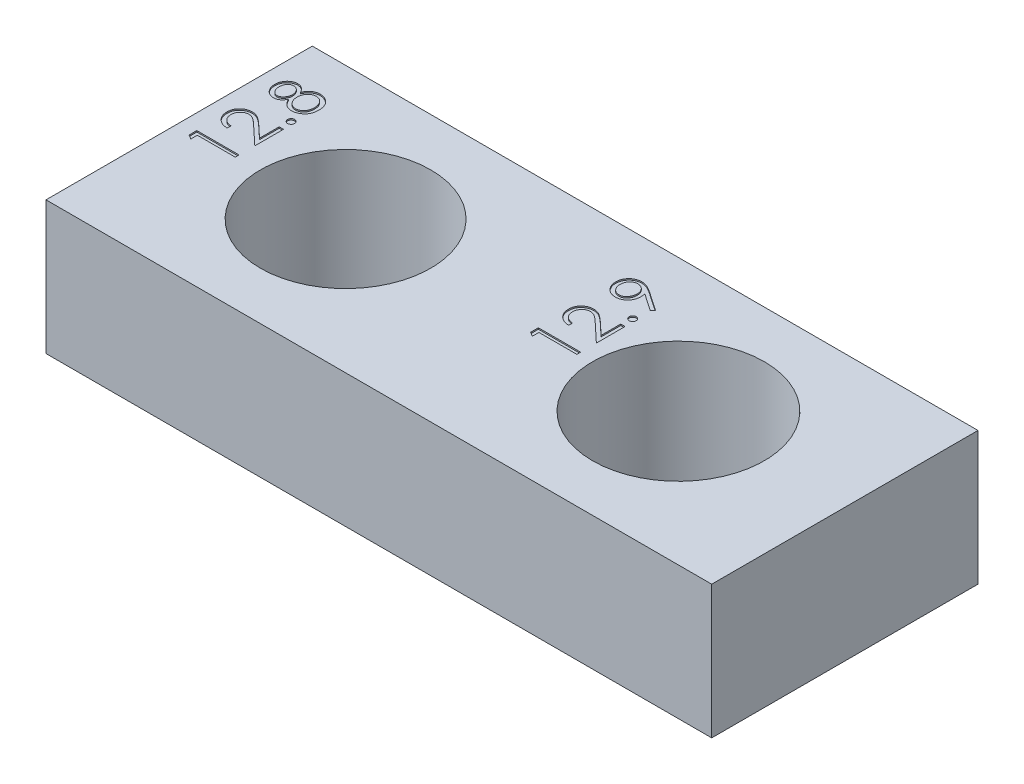
from build123d import *

# Parameters (mm, degrees)
SKETCH1_W           = 50
SKETCH1_H           = 20
SKETCH1_R           = 6.4
SKETCH1_R_2         = 6.45
BOSS_EXTRUDE1_DEPTH = 10
CUT_EXTRUDE1_DEPTH  = 0.1


with BuildPart() as part:
    # Sketch1 → Boss-Extrude1 (new body)
    with BuildSketch(Plane(origin=(0, 0, 0), x_dir=(1, 0, 0), z_dir=(0, 1, 0))):
        Rectangle(SKETCH1_W, SKETCH1_H)
        with Locations((-12.5, 0)):
            Circle(SKETCH1_R, mode=Mode.SUBTRACT)
        with Locations((12.5, 0)):
            Circle(SKETCH1_R_2, mode=Mode.SUBTRACT)
    extrude(amount=BOSS_EXTRUDE1_DEPTH)

    # Sketch2 → Cut-Extrude1 (cut)
    # profile 1 of 8: a face of its own
    with BuildSketch(Plane(origin=(0, 10, 0), x_dir=(1, 0, 0), z_dir=(0, 1, 0))):
        with BuildLine():
            add(Edge.make_bspline(
                [(-22.436668079, 6.557215324), (-22.423136448, 6.583216737), (-22.396745248, 6.633928176), (-22.353984147, 6.70583337), (-22.31007875, 6.772458633), (-22.264190213, 6.833439211), (-22.217345668, 6.889555281), (-22.168942574, 6.939979163), (-22.119046377, 6.98492396), (-22.067472562, 7.024318053), (-22.014212063, 7.059181762), (-21.958926282, 7.088756983), (-21.902361135, 7.114557459), (-21.843671906, 7.134810342), (-21.783660029, 7.151530662), (-21.721521238, 7.163026776), (-21.657672946, 7.16921136), (-21.614521652, 7.170380407), (-21.592672686, 7.170972335)],
                knots=[0, 0, 0, 0, 1.272232798, 2.48127884, 3.629933602, 4.734339846, 5.792529071, 6.8014233, 7.765980239, 8.70477066, 9.616091719, 10.526157162, 11.424183119, 12.311964017, 13.218439077, 14.126407968, 15.05133675, 16, 16, 16, 16], degree=3))
            add(Edge.make_bspline(
                [(-21.592672686, 7.170972335), (-21.562104795, 7.170270271), (-21.501599469, 7.168880622), (-21.412283642, 7.15684872), (-21.325393217, 7.138620365), (-21.241096829, 7.11266573), (-21.160192536, 7.077980829), (-21.082212424, 7.036032377), (-21.00582648, 6.988274118), (-20.958817102, 6.949949729), (-20.935030459, 6.930557671)],
                knots=[0, 0, 0, 0, 1.025234619, 2.029323995, 3.018511574, 4.001747246, 4.983437759, 5.966776356, 6.971193253, 8, 8, 8, 8], degree=3))
            add(Edge.make_bspline(
                [(-20.935030459, 6.930557671), (-20.907277535, 6.905306012), (-20.852114638, 6.855114737), (-20.780494975, 6.769133081), (-20.720306596, 6.674770372), (-20.671255663, 6.572391742), (-20.633077777, 6.462270857), (-20.605643493, 6.344431181), (-20.589929575, 6.218642985), (-20.587658098, 6.132187308), (-20.586492799, 6.087834314)],
                knots=[0, 0, 0, 0, 0.954267603, 1.896743057, 2.838368354, 3.796610408, 4.779680527, 5.799409237, 6.871065594, 8, 8, 8, 8], degree=3))
            add(Edge.make_bspline(
                [(-20.586492799, 6.087834314), (-20.587538261, 6.045186454), (-20.589572624, 5.962198051), (-20.603356143, 5.841404833), (-20.627511425, 5.728807481), (-20.660571884, 5.623751279), (-20.703579761, 5.526869667), (-20.757108722, 5.438438354), (-20.819004737, 5.357182751), (-20.891043342, 5.28556408), (-20.968207756, 5.221994572), (-21.04779408, 5.166105536), (-21.129740998, 5.119913172), (-21.212802876, 5.080099132), (-21.298662501, 5.050469743), (-21.386438816, 5.029454628), (-21.475882441, 5.016254204), (-21.536234428, 5.014488713), (-21.566595964, 5.01360054)],
                knots=[0, 0, 0, 0, 1.25688423, 2.445769047, 3.576901867, 4.645929967, 5.686364546, 6.692558921, 7.686102643, 8.689032542, 9.678639083, 10.630214757, 11.550908986, 12.44815258, 13.341318614, 14.221806242, 15.105436345, 16, 16, 16, 16], degree=3))
            add(Edge.make_bspline(
                [(-21.566595964, 5.01360054), (-21.588874592, 5.014124914), (-21.632905026, 5.015161263), (-21.6979566, 5.022329868), (-21.761268075, 5.03386649), (-21.823094745, 5.049492827), (-21.883090377, 5.070890065), (-21.941639369, 5.096182683), (-21.998357798, 5.126251217), (-22.053665927, 5.160770112), (-22.106903599, 5.200957441), (-22.158930094, 5.246495544), (-22.209091231, 5.297991322), (-22.257097949, 5.355812676), (-22.305433175, 5.417929336), (-22.35051663, 5.486968659), (-22.395759612, 5.560737978), (-22.422797956, 5.613177494), (-22.436668079, 5.640077904)],
                knots=[0, 0, 0, 0, 0.941515718, 1.860767376, 2.762381872, 3.659935523, 4.55260077, 5.451495189, 6.353332278, 7.263234701, 8.204067976, 9.169206831, 10.183030162, 11.238523545, 12.34427893, 13.507326683, 14.721309093, 16, 16, 16, 16], degree=3))
            add(Edge.make_bspline(
                [(-22.436668079, 5.640077904), (-22.45680892, 5.603304364), (-22.495746243, 5.532211841), (-22.566339406, 5.437117021), (-22.644466442, 5.356694686), (-22.729326182, 5.290880367), (-22.819224804, 5.239334322), (-22.913413908, 5.203927365), (-23.010223888, 5.179984955), (-23.076359792, 5.177612535), (-23.10957473, 5.176421053)],
                knots=[0, 0, 0, 0, 1.166795445, 2.255709742, 3.287146686, 4.280506455, 5.237809939, 6.161201476, 7.076514059, 8, 8, 8, 8], degree=3))
            add(Edge.make_bspline(
                [(-23.10957473, 5.176421053), (-23.143407418, 5.177907219), (-23.211417022, 5.180894672), (-23.312683206, 5.204969465), (-23.412200099, 5.244496504), (-23.509723302, 5.297347688), (-23.600862195, 5.3645714), (-23.68298768, 5.444157071), (-23.754903109, 5.535463922), (-23.815305992, 5.637648039), (-23.864455899, 5.747630101), (-23.898364113, 5.863667007), (-23.920530991, 5.983742572), (-23.923040765, 6.065474041), (-23.924313311, 6.106914843)],
                knots=[0, 0, 0, 0, 0.888671842, 1.786385383, 2.719922424, 3.697584571, 4.694127107, 5.68736021, 6.695307759, 7.740011808, 8.800474061, 9.853175224, 10.911482437, 12, 12, 12, 12], degree=3))
            add(Edge.make_bspline(
                [(-23.924313311, 6.106914843), (-23.923001321, 6.147286212), (-23.920414224, 6.226893952), (-23.898835419, 6.343909771), (-23.862797735, 6.455876532), (-23.813895275, 6.562391517), (-23.753709436, 6.661609085), (-23.680741788, 6.748985715), (-23.599585047, 6.826806615), (-23.507926908, 6.89081781), (-23.410778802, 6.943256098), (-23.309402172, 6.980176205), (-23.205838085, 7.003688776), (-23.135774118, 7.006662113), (-23.100670483, 7.008151822)],
                knots=[0, 0, 0, 0, 1.072838999, 2.115516285, 3.151283082, 4.193045685, 5.225601509, 6.226687556, 7.21162948, 8.206378771, 9.189883966, 10.138656908, 11.067424936, 12, 12, 12, 12], degree=3))
            add(Edge.make_bspline(
                [(-23.100670483, 7.008151822), (-23.066223451, 7.00684241), (-22.99857144, 7.0042708), (-22.900089097, 6.982928607), (-22.808062824, 6.94641232), (-22.721010861, 6.897203006), (-22.64069752, 6.832512082), (-22.565435496, 6.754399435), (-22.496088812, 6.662046876), (-22.456889273, 6.592890063), (-22.436668079, 6.557215324)],
                knots=[0, 0, 0, 0, 0.97540661, 1.915643144, 2.83819279, 3.771804602, 4.738123289, 5.749225578, 6.838931607, 8, 8, 8, 8], degree=3))
        make_face()
        with BuildLine():
            add(Edge.make_bspline(
                [(-23.598672286, 6.091014402), (-23.598083249, 6.068742536), (-23.596930836, 6.025169026), (-23.590863705, 5.961291062), (-23.579209698, 5.900498333), (-23.563243866, 5.842458401), (-23.543379172, 5.786972444), (-23.51720676, 5.735312854), (-23.488116016, 5.685743572), (-23.453993897, 5.639890766), (-23.416765928, 5.598382334), (-23.377887177, 5.561307987), (-23.336211518, 5.531103901), (-23.293823927, 5.505118217), (-23.248966274, 5.485820218), (-23.20262073, 5.472111585), (-23.154493747, 5.462409878), (-23.121707559, 5.461710654), (-23.105122606, 5.46135695)],
                knots=[0, 0, 0, 0, 1.20353747, 2.354645537, 3.462130888, 4.543058862, 5.604822423, 6.639552563, 7.666902586, 8.706944258, 9.720926464, 10.677177239, 11.602682187, 12.496457588, 13.358248655, 14.231532794, 15.105417644, 16, 16, 16, 16], degree=3))
            add(Edge.make_bspline(
                [(-23.105122606, 5.46135695), (-23.088539573, 5.46198049), (-23.055769116, 5.463212695), (-23.007376795, 5.472742347), (-22.959822881, 5.486945351), (-22.914238126, 5.509307022), (-22.869041222, 5.536127933), (-22.825361762, 5.569230915), (-22.783047734, 5.608681676), (-22.742459041, 5.653156568), (-22.704450877, 5.701608463), (-22.671455205, 5.752938274), (-22.643847119, 5.806501786), (-22.620869731, 5.861748663), (-22.603008145, 5.919241969), (-22.590336587, 5.978629412), (-22.582460776, 6.039920975), (-22.581520049, 6.081450502), (-22.581044081, 6.102462719)],
                knots=[0, 0, 0, 0, 0.873023192, 1.725219244, 2.590779336, 3.480155217, 4.391973325, 5.357036234, 6.360879153, 7.436073238, 8.526419356, 9.601555421, 10.645666583, 11.697338044, 12.750135903, 13.812665442, 14.89329948, 16, 16, 16, 16], degree=3))
            add(Edge.make_bspline(
                [(-22.581044081, 6.102462719), (-22.581831903, 6.129451929), (-22.583399766, 6.183163779), (-22.598110234, 6.262314707), (-22.620956981, 6.339468576), (-22.65338381, 6.413165502), (-22.692919906, 6.482086483), (-22.739544029, 6.544287664), (-22.794351108, 6.597166041), (-22.854161919, 6.642152082), (-22.91760674, 6.677324798), (-22.981535756, 6.70426765), (-23.046475546, 6.720134611), (-23.089990198, 6.722197186), (-23.111482783, 6.723215925)],
                knots=[0, 0, 0, 0, 1.076561449, 2.142489767, 3.202892658, 4.283174188, 5.348766409, 6.369549039, 7.375093932, 8.378927502, 9.349008457, 10.26378795, 11.142457041, 12, 12, 12, 12], degree=3))
            add(Edge.make_bspline(
                [(-23.111482783, 6.723215925), (-23.126569225, 6.722741095), (-23.156513652, 6.721798626), (-23.200891124, 6.713757167), (-23.244235051, 6.701115346), (-23.286635032, 6.683022554), (-23.327886596, 6.659787954), (-23.369085289, 6.632627096), (-23.408326305, 6.598919622), (-23.446972003, 6.561412921), (-23.482632442, 6.518786153), (-23.514227628, 6.471446543), (-23.539988551, 6.41884243), (-23.561869514, 6.362101214), (-23.578075891, 6.300611436), (-23.590284736, 6.234950982), (-23.597148867, 6.164513453), (-23.598153466, 6.116045453), (-23.598672286, 6.091014402)],
                knots=[0, 0, 0, 0, 0.814197944, 1.616066217, 2.427603245, 3.248455667, 4.099186941, 4.981981106, 5.90846497, 6.888109974, 7.887887681, 8.904052014, 9.953721043, 11.044545063, 12.183287691, 13.382474488, 14.648192314, 16, 16, 16, 16], degree=3))
        make_face(mode=Mode.SUBTRACT)
        with BuildLine():
            add(Edge.make_bspline(
                [(-22.255403055, 6.109458913), (-22.254900492, 6.081223555), (-22.253914587, 6.025832672), (-22.242952367, 5.944679969), (-22.22766865, 5.866807947), (-22.204570242, 5.792425776), (-22.174268293, 5.721852102), (-22.138944238, 5.653879915), (-22.095952861, 5.590167637), (-22.04710759, 5.530845453), (-21.994436519, 5.476410277), (-21.938100352, 5.429315846), (-21.880281292, 5.388715326), (-21.819660696, 5.356245736), (-21.757576937, 5.329555573), (-21.692435075, 5.312037644), (-21.625500186, 5.300804991), (-21.579997735, 5.299296838), (-21.557055699, 5.298536437)],
                knots=[0, 0, 0, 0, 1.140120093, 2.236637429, 3.303440304, 4.343881959, 5.376465234, 6.40341898, 7.434544382, 8.475444373, 9.50525236, 10.49018835, 11.438301835, 12.354413346, 13.264416842, 14.162243115, 15.073415118, 16, 16, 16, 16], degree=3))
            add(Edge.make_bspline(
                [(-21.557055699, 5.298536437), (-21.528550185, 5.299799376), (-21.471788901, 5.302314189), (-21.388080099, 5.321446598), (-21.307294193, 5.353111557), (-21.229807339, 5.39646342), (-21.157343458, 5.450476265), (-21.094015972, 5.516571215), (-21.038653408, 5.591608907), (-20.993019671, 5.676730788), (-20.957040872, 5.770170421), (-20.930978424, 5.871081907), (-20.914717594, 5.978758872), (-20.913008653, 6.053006216), (-20.912133824, 6.091014402)],
                knots=[0, 0, 0, 0, 0.898929492, 1.789983246, 2.69439732, 3.628772362, 4.584083338, 5.535003999, 6.506411961, 7.518169435, 8.572915583, 9.658441722, 10.801325702, 12, 12, 12, 12], degree=3))
            add(Edge.make_bspline(
                [(-20.912133824, 6.091014402), (-20.912711568, 6.120721337), (-20.913837198, 6.178599973), (-20.923545874, 6.263074455), (-20.939452438, 6.342588406), (-20.960806767, 6.417791157), (-20.989647489, 6.488054742), (-21.024901047, 6.553681728), (-21.065400447, 6.615497317), (-21.113327955, 6.670718314), (-21.164568767, 6.721001924), (-21.218805382, 6.764847696), (-21.274572944, 6.802909043), (-21.333129357, 6.832782162), (-21.393351798, 6.856663825), (-21.455795434, 6.873830195), (-21.520651825, 6.88442219), (-21.564647411, 6.885493431), (-21.586948528, 6.886036437)],
                knots=[0, 0, 0, 0, 1.224881218, 2.3864614, 3.501053153, 4.5663711, 5.605533372, 6.626474706, 7.635288001, 8.646258782, 9.635558885, 10.592810877, 11.51917626, 12.414699553, 13.29797396, 14.186770504, 15.080884095, 16, 16, 16, 16], degree=3))
            add(Edge.make_bspline(
                [(-21.586948528, 6.886036437), (-21.608608725, 6.885214747), (-21.651318849, 6.883594519), (-21.714606506, 6.87330988), (-21.775752582, 6.855245776), (-21.835479973, 6.830446629), (-21.892627189, 6.797479837), (-21.948623706, 6.758380896), (-22.002511557, 6.711922781), (-22.053539448, 6.658676838), (-22.100696197, 6.60093557), (-22.14260765, 6.53975171), (-22.17686121, 6.474835231), (-22.205636897, 6.407475034), (-22.228061902, 6.336991288), (-22.243786627, 6.26372417), (-22.253669602, 6.187534821), (-22.25481871, 6.135778238), (-22.255403055, 6.109458913)],
                knots=[0, 0, 0, 0, 0.917285732, 1.808727228, 2.70647511, 3.61182169, 4.540502712, 5.494399442, 6.50027777, 7.547876848, 8.61347749, 9.654284431, 10.682470341, 11.71628462, 12.752590585, 13.809114363, 14.885888007, 16, 16, 16, 16], degree=3))
        make_face(mode=Mode.SUBTRACT)
    # profile 2 of 8: a face of its own
    with BuildSketch(Plane(origin=(0, 10, 0), x_dir=(1, 0, 0), z_dir=(0, 1, 0))):
        with BuildLine():
            add(Edge.make_bspline(
                [(-21.156364593, 4.301260796), (-21.155313971, 4.318941203), (-21.153254348, 4.353601574), (-21.13912408, 4.403711354), (-21.114033723, 4.449063653), (-21.080593917, 4.48946076), (-21.040048566, 4.522758778), (-20.995057991, 4.548743298), (-20.94452869, 4.562750477), (-20.909667484, 4.564795097), (-20.89178126, 4.56584413)],
                knots=[0, 0, 0, 0, 1.020151414, 1.999887582, 2.974338812, 3.990962822, 5.007586832, 5.987933904, 6.967670073, 8, 8, 8, 8], degree=3))
            add(Edge.make_bspline(
                [(-20.89178126, 4.56584413), (-20.874321814, 4.56476289), (-20.839892043, 4.5626307), (-20.789787239, 4.548736978), (-20.744745065, 4.522790322), (-20.704294749, 4.489248902), (-20.670047257, 4.44930524), (-20.645289543, 4.403569465), (-20.630098924, 4.353728289), (-20.628176754, 4.318963892), (-20.627197927, 4.301260796)],
                knots=[0, 0, 0, 0, 1.009624703, 1.990965087, 2.972917375, 3.991206001, 5.017354006, 5.993400798, 6.978178195, 8, 8, 8, 8], degree=3))
            add(Edge.make_bspline(
                [(-20.627197927, 4.301260796), (-20.628141222, 4.28354495), (-20.629982783, 4.248958979), (-20.64560003, 4.199303622), (-20.669811009, 4.153289086), (-20.704357095, 4.113355804), (-20.744535832, 4.079542577), (-20.79009744, 4.05474706), (-20.83974845, 4.039648694), (-20.87429353, 4.037676065), (-20.89178126, 4.036677463)],
                knots=[0, 0, 0, 0, 1.022258411, 1.995716197, 2.98297171, 4.009558169, 5.028281891, 6.00474573, 6.989943903, 8, 8, 8, 8], degree=3))
            add(Edge.make_bspline(
                [(-20.89178126, 4.036677463), (-20.909696769, 4.037640939), (-20.944674601, 4.039522007), (-20.994748077, 4.054739927), (-21.040258018, 4.079574062), (-21.080532059, 4.113143242), (-21.114266255, 4.153533139), (-21.138817888, 4.199158982), (-21.153368834, 4.249087708), (-21.155348688, 4.283568152), (-21.156364593, 4.301260796)],
                knots=[0, 0, 0, 0, 1.032775665, 2.016367738, 2.991239715, 4.008302682, 5.025365648, 6.011011707, 6.979408107, 8, 8, 8, 8], degree=3))
        make_face()
    # profile 3 of 8: a face of its own
    with BuildSketch(Plane(origin=(0, 10, 0), x_dir=(1, 0, 0), z_dir=(0, 1, 0))):
        with BuildLine():
            Line((-22.865979978, 1.757190283), (-22.865979978, 1.472254386))
            add(Edge.make_bspline(
                [(-22.865979978, 1.472254386), (-22.903781426, 1.474111446), (-22.978022464, 1.477758663), (-23.086266294, 1.494838611), (-23.18973029, 1.519277836), (-23.287583712, 1.553832226), (-23.380691773, 1.596745778), (-23.468684644, 1.648208017), (-23.551226651, 1.709162439), (-23.627552602, 1.778292833), (-23.697572755, 1.853375813), (-23.758038583, 1.934389058), (-23.809126756, 2.019519904), (-23.851836168, 2.108510073), (-23.883894457, 2.202363584), (-23.90768123, 2.300228748), (-23.921992629, 2.402535536), (-23.923530949, 2.472240413), (-23.924313311, 2.507691085)],
                knots=[0, 0, 0, 0, 1.10065271, 2.161652631, 3.183658789, 4.190468796, 5.17591951, 6.163126047, 7.15150782, 8.156236427, 9.156009102, 10.134482811, 11.092018607, 12.041330605, 13.001268258, 13.972401359, 14.968799086, 16, 16, 16, 16], degree=3))
            add(Edge.make_bspline(
                [(-23.924313311, 2.507691085), (-23.923504897, 2.542507931), (-23.921916392, 2.610921789), (-23.908069607, 2.7107291), (-23.886850643, 2.805969211), (-23.855407482, 2.895562768), (-23.815953192, 2.980429251), (-23.766886614, 3.059517873), (-23.710529412, 3.13474108), (-23.644053329, 3.202407047), (-23.573123181, 3.264566401), (-23.497370379, 3.318144006), (-23.419039649, 3.364285461), (-23.337519114, 3.402050801), (-23.252543304, 3.430678607), (-23.164926911, 3.451889069), (-23.073658783, 3.464014114), (-23.01187463, 3.465864778), (-22.980463151, 3.466805668)],
                knots=[0, 0, 0, 0, 1.111674182, 2.184400057, 3.212814286, 4.223731311, 5.211378316, 6.196328225, 7.191884489, 8.207283132, 9.220262353, 10.201199469, 11.166417575, 12.120932471, 13.06540007, 14.026332106, 14.996573967, 16, 16, 16, 16], degree=3))
            add(Edge.make_bspline(
                [(-22.980463151, 3.466805668), (-22.93624192, 3.465269613), (-22.848575478, 3.462224457), (-22.719747431, 3.43617677), (-22.594931606, 3.395493231), (-22.494473629, 3.346514255), (-22.413533766, 3.297090251), (-22.346858979, 3.252596593), (-22.27508705, 3.200213183), (-22.197927484, 3.140387562), (-22.116390751, 3.072089447), (-22.028813282, 2.997093214), (-21.936814445, 2.91346206), (-21.873937063, 2.854816516), (-21.841355579, 2.824427864)],
                knots=[0, 0, 0, 0, 1.184416499, 2.348048165, 3.509039915, 4.696071444, 5.333504901, 6.05069495, 6.844171097, 7.714965912, 8.667477798, 9.695072654, 10.805644396, 12, 12, 12, 12], degree=3))
            Line((-21.841355579, 2.824427864), (-20.993544081, 2.030041846))
            Line((-20.993544081, 2.030041846), (-20.993544081, 3.507510796))
            Line((-20.993544081, 3.507510796), (-20.667903055, 3.507510796))
            Line((-20.667903055, 3.507510796), (-20.667903055, 1.350139001))
            Line((-20.667903055, 1.350139001), (-21.981915475, 2.58146913))
            add(Edge.make_bspline(
                [(-21.981915475, 2.58146913), (-22.013210367, 2.611448284), (-22.073321451, 2.669032104), (-22.161081136, 2.750477728), (-22.242496791, 2.82362881), (-22.317414588, 2.888958873), (-22.386930368, 2.945050696), (-22.448792706, 2.994827649), (-22.505719957, 3.034710721), (-22.571706086, 3.077995402), (-22.652271545, 3.119918085), (-22.750727106, 3.155942865), (-22.852079685, 3.177909192), (-22.920570819, 3.180544292), (-22.955022446, 3.181869771)],
                knots=[0, 0, 0, 0, 1.329631726, 2.553950428, 3.673215718, 4.687767853, 5.603093632, 6.413772471, 7.123043292, 7.734684054, 8.834405432, 9.900288307, 10.943827018, 12, 12, 12, 12], degree=3))
            add(Edge.make_bspline(
                [(-22.955022446, 3.181869771), (-22.976686286, 3.181293062), (-23.019381555, 3.180156479), (-23.081979636, 3.170125567), (-23.142363431, 3.154966751), (-23.200718679, 3.133244981), (-23.256458663, 3.104573153), (-23.309651234, 3.069672301), (-23.361076224, 3.029404172), (-23.409293859, 2.982821235), (-23.453454667, 2.931647928), (-23.492574373, 2.87758743), (-23.525266995, 2.820391978), (-23.552067167, 2.760302724), (-23.573090549, 2.697487191), (-23.587657974, 2.631823887), (-23.596804228, 2.563494244), (-23.598041726, 2.516836715), (-23.598672286, 2.493062679)],
                knots=[0, 0, 0, 0, 0.991446411, 1.95395049, 2.89581595, 3.838931463, 4.798493298, 5.75982156, 6.748411868, 7.785213223, 8.824556874, 9.840280684, 10.836137867, 11.835679398, 12.848801643, 13.863922112, 14.911575587, 16, 16, 16, 16], degree=3))
            add(Edge.make_bspline(
                [(-23.598672286, 2.493062679), (-23.598049243, 2.468227192), (-23.596825691, 2.419454395), (-23.587557898, 2.347997128), (-23.573507918, 2.279359307), (-23.551193484, 2.214565068), (-23.524827871, 2.152211335), (-23.491333201, 2.09362926), (-23.45241165, 2.037846201), (-23.407280525, 1.985779682), (-23.356572443, 1.93822638), (-23.300688636, 1.895857074), (-23.240031424, 1.859080522), (-23.174849754, 1.826948508), (-23.104494661, 1.800866016), (-23.029231876, 1.780932371), (-22.949383691, 1.765160258), (-22.894242966, 1.759891066), (-22.865979978, 1.757190283)],
                knots=[0, 0, 0, 0, 1.030878251, 2.024474673, 2.987898669, 3.934362936, 4.864849709, 5.795128259, 6.730474222, 7.685293701, 8.650606017, 9.611896181, 10.591709709, 11.591680886, 12.625074257, 13.701333388, 14.821793024, 16, 16, 16, 16], degree=3))
        make_face()
    # profile 4 of 8: a face of its own
    with BuildSketch(Plane(origin=(0, 10, 0), x_dir=(1, 0, 0), z_dir=(0, 1, 0))):
        Polygon((-23.842903055, -0.417353987), (-23.842903055, 0.169690283), (-20.667903055, 0.169690283), (-20.667903055, -0.115245614), (-23.517262029, -0.115245614), (-23.517262029, -0.603707152), align=None)
    # profile 5 of 8: a face of its own
    with BuildSketch(Plane(origin=(0, 10, 0), x_dir=(1, 0, 0), z_dir=(0, 1, 0))):
        with BuildLine():
            Line((5.068635407, 5.705587719), (4.910267017, 5.477893408))
            Line((4.910267017, 5.477893408), (3.619787249, 6.360685876))
            add(Edge.make_bspline(
                [(3.619787249, 6.360685876), (3.626996648, 6.304368496), (3.641188587, 6.193505878), (3.643043358, 6.081757607), (3.643955919, 6.026776622)],
                knots=[0, 0, 0, 0, 1.015985029, 2, 2, 2, 2], degree=3))
            add(Edge.make_bspline(
                [(3.643955919, 6.026776622), (3.643102229, 5.993446335), (3.641426508, 5.928021898), (3.628144297, 5.831836041), (3.607688108, 5.739411286), (3.577163886, 5.650992643), (3.539228773, 5.566247857), (3.492187142, 5.485361627), (3.436845382, 5.408443997), (3.373498172, 5.336316644), (3.303935443, 5.270729846), (3.230332923, 5.212251644), (3.151896077, 5.163916401), (3.070279155, 5.123047473), (2.98374013, 5.09292227), (2.893747408, 5.070454849), (2.799742368, 5.056774101), (2.73576799, 5.055136923), (2.703285847, 5.054305668)],
                knots=[0, 0, 0, 0, 1.060698949, 2.082059282, 3.085738422, 4.069684654, 5.054463875, 6.037298355, 7.043153692, 8.066652628, 9.088369706, 10.083456696, 11.053578809, 12.016466116, 12.983507685, 13.964045196, 14.966270913, 16, 16, 16, 16], degree=3))
            add(Edge.make_bspline(
                [(2.703285847, 5.054305668), (2.658865996, 5.055882211), (2.57167884, 5.058976643), (2.444260977, 5.08378601), (2.323715256, 5.124890552), (2.210176474, 5.1813044), (2.106252618, 5.253721805), (2.012295787, 5.339722839), (1.929982034, 5.440002588), (1.859305988, 5.551942911), (1.802076844, 5.672753363), (1.761417976, 5.799804257), (1.735444141, 5.930955342), (1.732364631, 6.020084296), (1.730814894, 6.064937679)],
                knots=[0, 0, 0, 0, 1.023011052, 2.007963168, 2.978169221, 3.950402619, 4.919353283, 5.887490769, 6.876420893, 7.899700203, 8.931203047, 9.947778163, 10.96723692, 12, 12, 12, 12], degree=3))
            add(Edge.make_bspline(
                [(1.730814894, 6.064937679), (1.732475122, 6.108923588), (1.735755577, 6.195835599), (1.759780189, 6.323642265), (1.800272521, 6.446052252), (1.856227375, 6.562391761), (1.926375379, 6.670094289), (2.009929322, 6.766995762), (2.106958979, 6.85052477), (2.214798965, 6.921739763), (2.33138081, 6.977840725), (2.452839723, 7.018948486), (2.578445121, 7.044076191), (2.663527182, 7.047253462), (2.706465935, 7.04885695)],
                knots=[0, 0, 0, 0, 1.026358223, 2.027987109, 3.023239252, 4.028077889, 5.032770297, 6.015020143, 7.004250571, 8.011656937, 9.02310243, 10.015224881, 10.998334443, 12, 12, 12, 12], degree=3))
            add(Edge.make_bspline(
                [(2.706465935, 7.04885695), (2.739796556, 7.047783204), (2.807399382, 7.045605378), (2.909930549, 7.030528446), (3.014388929, 7.004521738), (3.102888992, 6.975462841), (3.176206529, 6.946980227), (3.234292063, 6.920942919), (3.295004897, 6.890696988), (3.358593645, 6.856917811), (3.425141274, 6.819669383), (3.494186221, 6.77793912), (3.565829152, 6.732289879), (3.61413296, 6.699789306), (3.638867778, 6.683146814)],
                knots=[0, 0, 0, 0, 1.179894106, 2.393120058, 3.660107319, 4.986885617, 5.687958251, 6.443931318, 7.239444731, 8.088894906, 8.992865148, 9.938946712, 10.944601238, 12, 12, 12, 12], degree=3))
            Line((3.638867778, 6.683146814), (5.068635407, 5.705587719))
        make_face()
        with BuildLine():
            add(Edge.make_bspline(
                [(3.318314894, 6.079566085), (3.317623688, 6.104814906), (3.316278145, 6.153965776), (3.308125296, 6.225980735), (3.293563249, 6.293917415), (3.272999605, 6.358213062), (3.246949574, 6.418789839), (3.215203348, 6.475666827), (3.177065432, 6.528263053), (3.134197651, 6.576765768), (3.087216266, 6.620783457), (3.036880075, 6.65873685), (2.98475285, 6.69159762), (2.92976747, 6.717813167), (2.872823432, 6.738940215), (2.813097218, 6.753681931), (2.751001199, 6.761823983), (2.708820761, 6.763214445), (2.687385407, 6.763921053)],
                knots=[0, 0, 0, 0, 1.163726718, 2.265380301, 3.334713825, 4.36057981, 5.371541381, 6.368955992, 7.355979581, 8.359691305, 9.348261197, 10.317521986, 11.261029684, 12.183096459, 13.119698615, 14.055740009, 15.011961376, 16, 16, 16, 16], degree=3))
            add(Edge.make_bspline(
                [(2.687385407, 6.763921053), (2.66594056, 6.763314156), (2.623680858, 6.762118191), (2.56150067, 6.752505536), (2.501891795, 6.735641293), (2.444448435, 6.712784554), (2.389484614, 6.68324568), (2.3368271, 6.647455276), (2.287272946, 6.604237604), (2.240005462, 6.55594378), (2.197125856, 6.502826351), (2.159240645, 6.446548107), (2.127267597, 6.387409692), (2.102019819, 6.325147293), (2.081335949, 6.260606412), (2.066693652, 6.193118899), (2.058536117, 6.122591483), (2.057158151, 6.074710232), (2.056455919, 6.050309274)],
                knots=[0, 0, 0, 0, 0.971910406, 1.91526867, 2.84337505, 3.775008003, 4.712374136, 5.666733183, 6.654995996, 7.688089235, 8.726800303, 9.745078658, 10.75990398, 11.768337501, 12.786615857, 13.829099629, 14.893678693, 16, 16, 16, 16], degree=3))
            add(Edge.make_bspline(
                [(2.056455919, 6.050309274), (2.057159304, 6.026120532), (2.05853934, 5.97866242), (2.066677981, 5.908761958), (2.081435418, 5.841730878), (2.102010446, 5.777377344), (2.12726953, 5.715116749), (2.159242332, 5.655981123), (2.197117062, 5.599689768), (2.240039604, 5.546622869), (2.287052534, 5.498242003), (2.337048528, 5.455755637), (2.389456738, 5.419884295), (2.444455797, 5.390386685), (2.501889838, 5.367519033), (2.5615012, 5.350657703), (2.62368072, 5.341044265), (2.665940513, 5.339848408), (2.687385407, 5.339241566)],
                knots=[0, 0, 0, 0, 1.099107991, 2.156440826, 3.191784126, 4.212280276, 5.222910149, 6.239945746, 7.260441896, 8.30141526, 9.33675856, 10.320924759, 11.277362386, 12.216770088, 13.150432123, 14.080559904, 15.025972789, 16, 16, 16, 16], degree=3))
            add(Edge.make_bspline(
                [(2.687385407, 5.339241566), (2.708837389, 5.339791824), (2.751144626, 5.340877035), (2.813312344, 5.351325787), (2.872884174, 5.36884601), (2.930368642, 5.392077919), (2.985022048, 5.423255811), (3.037127796, 5.461145965), (3.087751116, 5.504864735), (3.134050753, 5.555844883), (3.177270606, 5.610588746), (3.214963552, 5.669389485), (3.246570246, 5.731065469), (3.273076395, 5.795220694), (3.293355821, 5.862335217), (3.308098247, 5.932315578), (3.316199983, 6.005174383), (3.31760316, 6.054530944), (3.318314894, 6.079566085)],
                knots=[0, 0, 0, 0, 0.952872936, 1.879239831, 2.791748947, 3.708674669, 4.628500839, 5.580394867, 6.568761142, 7.595635223, 8.636123962, 9.665976811, 10.694276597, 11.712685318, 12.747011694, 13.805940053, 14.887106426, 16, 16, 16, 16], degree=3))
        make_face(mode=Mode.SUBTRACT)
    # profile 6 of 8: a face of its own
    with BuildSketch(Plane(origin=(0, 10, 0), x_dir=(1, 0, 0), z_dir=(0, 1, 0))):
        with BuildLine():
            add(Edge.make_bspline(
                [(4.498763612, 4.301260796), (4.499814234, 4.318941203), (4.501873857, 4.353601574), (4.516004126, 4.403711354), (4.541094482, 4.449063653), (4.574534288, 4.48946076), (4.615079639, 4.522758778), (4.660070214, 4.548743298), (4.710599516, 4.562750477), (4.745460721, 4.564795097), (4.763346945, 4.56584413)],
                knots=[0, 0, 0, 0, 1.020151414, 1.999887582, 2.974338812, 3.990962822, 5.007586832, 5.987933904, 6.967670073, 8, 8, 8, 8], degree=3))
            add(Edge.make_bspline(
                [(4.763346945, 4.56584413), (4.780806391, 4.56476289), (4.815236162, 4.5626307), (4.865340966, 4.548736978), (4.91038314, 4.522790322), (4.950833456, 4.489248902), (4.985080948, 4.44930524), (5.009838663, 4.403569465), (5.025029281, 4.353728289), (5.026951451, 4.318963892), (5.027930278, 4.301260796)],
                knots=[0, 0, 0, 0, 1.009624703, 1.990965087, 2.972917375, 3.991206001, 5.017354006, 5.993400798, 6.978178195, 8, 8, 8, 8], degree=3))
            add(Edge.make_bspline(
                [(5.027930278, 4.301260796), (5.026986983, 4.28354495), (5.025145423, 4.248958979), (5.009528175, 4.199303622), (4.985317196, 4.153289086), (4.95077111, 4.113355804), (4.910592374, 4.079542577), (4.865030765, 4.05474706), (4.815379755, 4.039648694), (4.780834675, 4.037676065), (4.763346945, 4.036677463)],
                knots=[0, 0, 0, 0, 1.022258411, 1.995716197, 2.98297171, 4.009558169, 5.028281891, 6.00474573, 6.989943903, 8, 8, 8, 8], degree=3))
            add(Edge.make_bspline(
                [(4.763346945, 4.036677463), (4.745431436, 4.037640939), (4.710453604, 4.039522007), (4.660380128, 4.054739927), (4.614870187, 4.079574062), (4.574596146, 4.113143242), (4.54086195, 4.153533139), (4.516310317, 4.199158982), (4.501759371, 4.249087708), (4.499779517, 4.283568152), (4.498763612, 4.301260796)],
                knots=[0, 0, 0, 0, 1.032775665, 2.016367738, 2.991239715, 4.008302682, 5.025365648, 6.011011707, 6.979408107, 8, 8, 8, 8], degree=3))
        make_face()
    # profile 7 of 8: a face of its own
    with BuildSketch(Plane(origin=(0, 10, 0), x_dir=(1, 0, 0), z_dir=(0, 1, 0))):
        with BuildLine():
            Line((2.789148227, 1.757190283), (2.789148227, 1.472254386))
            add(Edge.make_bspline(
                [(2.789148227, 1.472254386), (2.751346779, 1.474111446), (2.677105741, 1.477758663), (2.568861911, 1.494838611), (2.465397915, 1.519277836), (2.367544493, 1.553832226), (2.274436432, 1.596745778), (2.186443561, 1.648208017), (2.103901554, 1.709162439), (2.027575604, 1.778292833), (1.95755545, 1.853375813), (1.897089623, 1.934389058), (1.846001449, 2.019519904), (1.803292037, 2.108510073), (1.771233748, 2.202363584), (1.747446975, 2.300228748), (1.733135576, 2.402535536), (1.731597256, 2.472240413), (1.730814894, 2.507691085)],
                knots=[0, 0, 0, 0, 1.10065271, 2.161652631, 3.183658789, 4.190468796, 5.17591951, 6.163126047, 7.15150782, 8.156236427, 9.156009102, 10.134482811, 11.092018607, 12.041330605, 13.001268258, 13.972401359, 14.968799086, 16, 16, 16, 16], degree=3))
            add(Edge.make_bspline(
                [(1.730814894, 2.507691085), (1.731623308, 2.542507931), (1.733211813, 2.610921789), (1.747058598, 2.7107291), (1.768277562, 2.805969211), (1.799720723, 2.895562768), (1.839175013, 2.980429251), (1.888241591, 3.059517873), (1.944598793, 3.13474108), (2.011074876, 3.202407047), (2.082005024, 3.264566401), (2.157757827, 3.318144006), (2.236088557, 3.364285461), (2.317609091, 3.402050801), (2.402584901, 3.430678607), (2.490201294, 3.451889069), (2.581469423, 3.464014114), (2.643253575, 3.465864778), (2.674665054, 3.466805668)],
                knots=[0, 0, 0, 0, 1.111674182, 2.184400057, 3.212814286, 4.223731311, 5.211378316, 6.196328225, 7.191884489, 8.207283132, 9.220262353, 10.201199469, 11.166417575, 12.120932471, 13.06540007, 14.026332106, 14.996573967, 16, 16, 16, 16], degree=3))
            add(Edge.make_bspline(
                [(2.674665054, 3.466805668), (2.718886285, 3.465269613), (2.806552727, 3.462224457), (2.935380774, 3.43617677), (3.060196599, 3.395493231), (3.160654576, 3.346514255), (3.241594439, 3.297090251), (3.308269226, 3.252596593), (3.380041155, 3.200213183), (3.457200721, 3.140387562), (3.538737454, 3.072089447), (3.626314923, 2.997093214), (3.718313761, 2.91346206), (3.781191142, 2.854816516), (3.813772626, 2.824427864)],
                knots=[0, 0, 0, 0, 1.184416499, 2.348048165, 3.509039915, 4.696071444, 5.333504901, 6.05069495, 6.844171097, 7.714965912, 8.667477798, 9.695072654, 10.805644396, 12, 12, 12, 12], degree=3))
            Line((3.813772626, 2.824427864), (4.661584124, 2.030041846))
            Line((4.661584124, 2.030041846), (4.661584124, 3.507510796))
            Line((4.661584124, 3.507510796), (4.98722515, 3.507510796))
            Line((4.98722515, 3.507510796), (4.98722515, 1.350139001))
            Line((4.98722515, 1.350139001), (3.67321273, 2.58146913))
            add(Edge.make_bspline(
                [(3.67321273, 2.58146913), (3.641917838, 2.611448284), (3.581806754, 2.669032104), (3.494047069, 2.750477728), (3.412631414, 2.82362881), (3.337713617, 2.888958873), (3.268197837, 2.945050696), (3.206335499, 2.994827649), (3.149408248, 3.034710721), (3.083422119, 3.077995402), (3.00285666, 3.119918085), (2.904401099, 3.155942865), (2.80304852, 3.177909192), (2.734557386, 3.180544292), (2.700105759, 3.181869771)],
                knots=[0, 0, 0, 0, 1.329631726, 2.553950428, 3.673215718, 4.687767853, 5.603093632, 6.413772471, 7.123043292, 7.734684054, 8.834405432, 9.900288307, 10.943827018, 12, 12, 12, 12], degree=3))
            add(Edge.make_bspline(
                [(2.700105759, 3.181869771), (2.678441919, 3.181293062), (2.635746651, 3.180156479), (2.573148569, 3.170125567), (2.512764774, 3.154966751), (2.454409526, 3.133244981), (2.398669542, 3.104573153), (2.345476971, 3.069672301), (2.294051981, 3.029404172), (2.245834346, 2.982821235), (2.201673538, 2.931647928), (2.162553832, 2.87758743), (2.12986121, 2.820391978), (2.103061038, 2.760302724), (2.082037656, 2.697487191), (2.067470231, 2.631823887), (2.058323978, 2.563494244), (2.057086479, 2.516836715), (2.056455919, 2.493062679)],
                knots=[0, 0, 0, 0, 0.991446411, 1.95395049, 2.89581595, 3.838931463, 4.798493298, 5.75982156, 6.748411868, 7.785213223, 8.824556874, 9.840280684, 10.836137867, 11.835679398, 12.848801643, 13.863922112, 14.911575587, 16, 16, 16, 16], degree=3))
            add(Edge.make_bspline(
                [(2.056455919, 2.493062679), (2.057078962, 2.468227192), (2.058302514, 2.419454395), (2.067570308, 2.347997128), (2.081620287, 2.279359307), (2.103934721, 2.214565068), (2.130300334, 2.152211335), (2.163795004, 2.09362926), (2.202716555, 2.037846201), (2.24784768, 1.985779682), (2.298555762, 1.93822638), (2.354439569, 1.895857074), (2.415096781, 1.859080522), (2.480278451, 1.826948508), (2.550633544, 1.800866016), (2.625896329, 1.780932371), (2.705744514, 1.765160258), (2.760885239, 1.759891066), (2.789148227, 1.757190283)],
                knots=[0, 0, 0, 0, 1.030878251, 2.024474673, 2.987898669, 3.934362936, 4.864849709, 5.795128259, 6.730474222, 7.685293701, 8.650606017, 9.611896181, 10.591709709, 11.591680886, 12.625074257, 13.701333388, 14.821793024, 16, 16, 16, 16], degree=3))
        make_face()
    # profile 8 of 8: a face of its own
    with BuildSketch(Plane(origin=(0, 10, 0), x_dir=(1, 0, 0), z_dir=(0, 1, 0))):
        Polygon((1.81222515, -0.417353987), (1.81222515, 0.169690283), (4.98722515, 0.169690283), (4.98722515, -0.115245614), (2.137866176, -0.115245614), (2.137866176, -0.603707152), align=None)
    extrude(amount=-CUT_EXTRUDE1_DEPTH, mode=Mode.SUBTRACT)


solid = part.part
